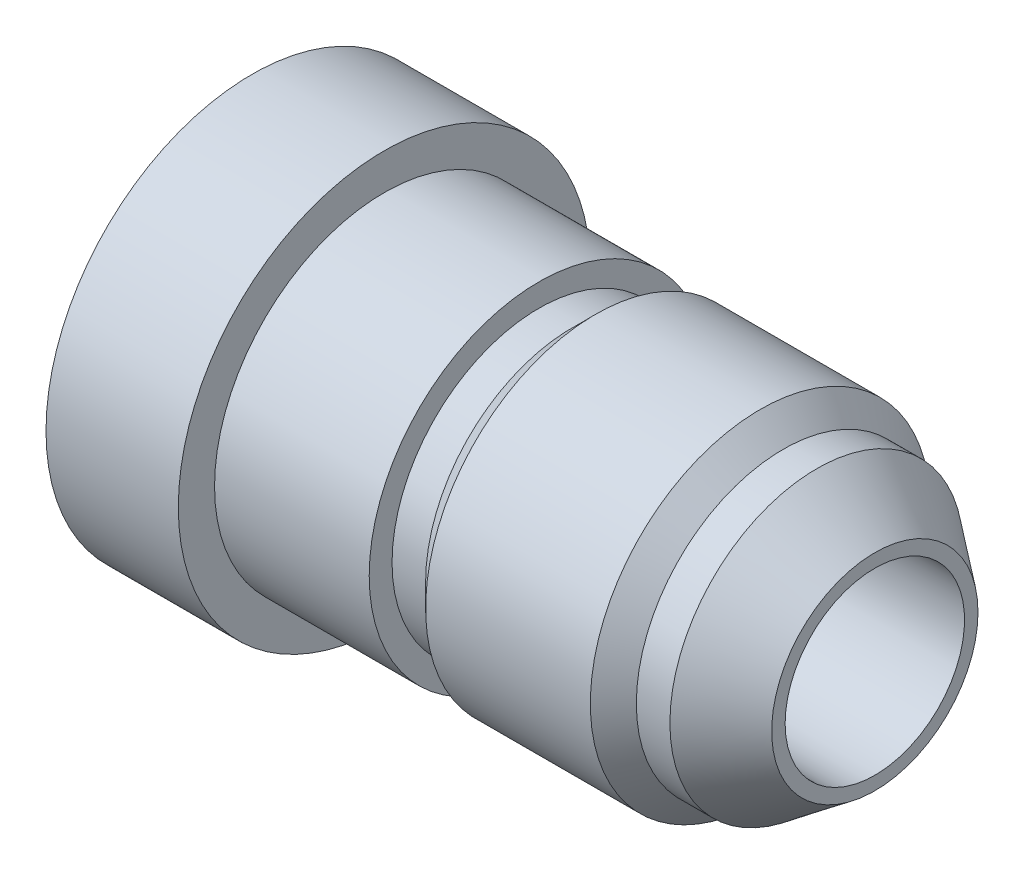
from build123d import *
from build123d.topology import SkipClean

# Parameters (mm, degrees)
CUT_SWEEP1_PITCH = 1.411111111


with BuildPart() as part:
    # Sketch1 → Revolve1 (revolve)
    with BuildSketch(Plane.XY, mode=Mode.PRIVATE) as revolve1_sk:
        Polygon((-13.0937, 8.6614), (-13.0937, 7.4803), (-8.172486984, 3.7719), (13.0937, 3.7719), (13.0937, 4.337685), (13.0937, 7.14375), (9.369925973, 7.14375), (-1.0287, 7.14375), (-1.0287, 7.1374), (-7.5311, 7.1374), (-7.5311, 8.6614), align=None)
    revolve(revolve1_sk.sketch.rotate(Axis((-13.0937, 0, 0), (1, 0, 0)), 90), axis=Axis((-13.0937, 0, 0), (1, 0, 0)))

    # Cut-Sweep1: the profile of Sketch4 profile screwed along a right-hand helix of 10.008 turns, 8 arcs to a turn; built about Z, then put on its axis
    cut_sweep1_z = Axis((0, 0, 0), (0, 0, 1))
    cut_sweep1_corners = [(7.14435, 0, 0.00034641), (7.14435, 0, -1.235068632), (6.227206448, 0, -0.705555556), (6.227206448, 0, -0.529166667)]
    with BuildLine(mode=Mode.PRIVATE) as cut_sweep1_profile:
        Line(cut_sweep1_corners[0], cut_sweep1_corners[1])
        Line(cut_sweep1_corners[1], cut_sweep1_corners[2])
        Line(cut_sweep1_corners[2], cut_sweep1_corners[3])
        Line(cut_sweep1_corners[3], cut_sweep1_corners[0])
    cut_sweep1_cap = Face(cut_sweep1_profile.wire())
    cut_sweep1_turn_angles = [0, 22.5, 45, 67.5, 90, 112.5, 135, 157.5, 180, 202.5, 225, 247.5, 270, 292.5, 315, 337.5, 360]
    cut_sweep1_turn_weights = [1, 0.9238795325112867, 1, 0.9238795325112867, 1, 0.9238795325112867, 1, 0.9238795325112867, 1, 0.9238795325112867, 1, 0.9238795325112867, 1, 0.9238795325112867, 1, 0.9238795325112867, 1]
    cut_sweep1_turn_rails = [Edge.make_bspline([Vector(p[0], p[1], 0).rotate(cut_sweep1_z, cut_sweep1_turn_angles[k]) / cut_sweep1_turn_weights[k] + Vector(0, 0, p[2] + CUT_SWEEP1_PITCH * cut_sweep1_turn_angles[k] / 360) for k in range(17)], [0, 0, 0, 1, 1, 2, 2, 3, 3, 4, 4, 5, 5, 6, 6, 7, 7, 8, 8, 8], 2, cut_sweep1_turn_weights) for p in cut_sweep1_corners]
    cut_sweep1_turn_sides = [Face.make_surface_from_curves(cut_sweep1_turn_rails[p[0]], cut_sweep1_turn_rails[p[1]]) for p in [(0, 1), (1, 2), (2, 3), (3, 0)]]
    cut_sweep1_last_angles = [3600, 3601.44, 3602.88]
    cut_sweep1_last_weights = [1, 0.9996841892832969, 1]
    cut_sweep1_last_rails = [Edge.make_bspline([Vector(p[0], p[1], 0).rotate(cut_sweep1_z, cut_sweep1_last_angles[k]) / cut_sweep1_last_weights[k] + Vector(0, 0, p[2] + CUT_SWEEP1_PITCH * cut_sweep1_last_angles[k] / 360) for k in range(3)], [0, 0, 0, 1, 1, 1], 2, cut_sweep1_last_weights) for p in cut_sweep1_corners]
    cut_sweep1_last_sides = [Face.make_surface_from_curves(cut_sweep1_last_rails[p[0]], cut_sweep1_last_rails[p[1]]) for p in [(0, 1), (1, 2), (2, 3), (3, 0)]]
    cut_sweep1 = Plane(origin=(13.0937, 0, 0), x_dir=(0, 1, 0), z_dir=(-1, 0, 0)) * Solid(Shell([*[p.moved(Location((0, 0, CUT_SWEEP1_PITCH * i))) for i in range(10) for p in cut_sweep1_turn_sides], *cut_sweep1_last_sides, cut_sweep1_cap, cut_sweep1_cap.rotate(cut_sweep1_z, 3602.88).moved(Location((0, 0, CUT_SWEEP1_PITCH * 3602.88 / 360)))]))
    add(cut_sweep1, mode=Mode.SUBTRACT)

    # Sketch5 → Cut-Revolve1 (revolve, cut)
    with BuildSketch(Plane.XY, mode=Mode.PRIVATE) as cut_revolve1_sk:
        Polygon((13.0937, 4.337685), (10.653634224, 6.176406448), (9.242523113, 6.176406448), (8.275179561, 7.14375), (13.0937, 7.14375), align=None)
        Polygon((-1.0287, 7.14375), (-1.0287, 6.176406448), (0.382411111, 6.176406448), (1.349754663, 7.14375), align=None)
    revolve(cut_revolve1_sk.sketch.rotate(Axis((0, 0, 0), (-1, 0, 0)), 90), axis=Axis((0, 0, 0), (-1, 0, 0)), mode=Mode.SUBTRACT)

    # Sketch6 → Revolve2 (revolve)
    with SkipClean():  # the faces are left unmerged after this step: merging them gives an invalid solid
        with BuildSketch(Plane.XY, mode=Mode.PRIVATE) as revolve2_sk:
            Polygon((1.349754663, 7.14375), (0.382411111, 6.176406448), (9.242523113, 6.176406448), (8.275179561, 7.14375), align=None)
        revolve(revolve2_sk.sketch.rotate(Axis((0, 0, 0), (-1, 0, 0)), 90), axis=Axis((0, 0, 0), (-1, 0, 0)))
    add(part.part.scale(1), mode=Mode.REPLACE)  # the faces are merged on a copy


solid = part.part
